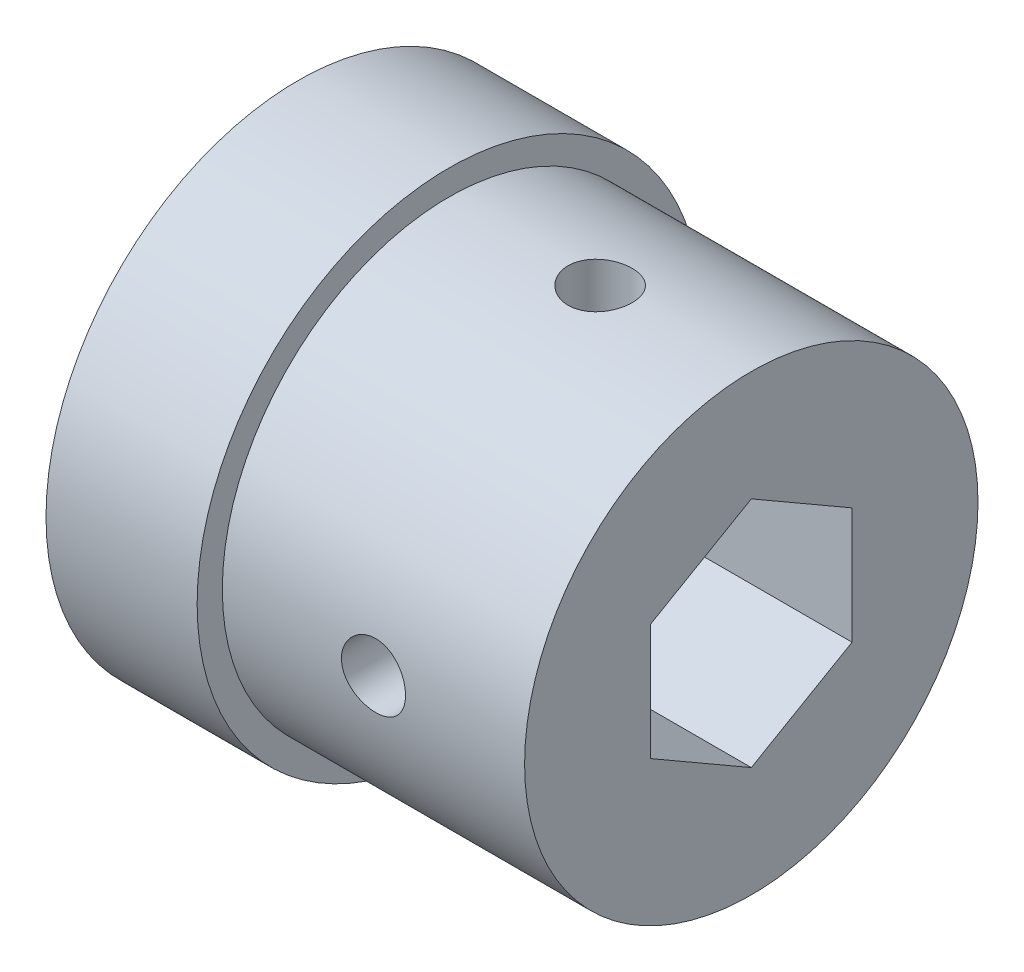
from build123d import *

# Parameters (mm, degrees)
SKETCH1_R               = 14.2875
BOSS_EXTRUDE1_DEPTH     = 19.05
SKETCH2_R               = 15.875
BOSS_EXTRUDE2_DEPTH     = 9.525
CUT_EXTRUDE1_DEPTH      = 37.339535977
CUT_EXTRUDE2_DEPTH      = 30.443738723
CUT_EXTRUDE2_DEPTH_BACK = 30.443738723
SKETCH5_R               = 2.0193
CUT_EXTRUDE3_DEPTH      = 30.443738788
CUT_EXTRUDE3_DEPTH_BACK = 30.443738788
SKETCH6_R               = 2.0193


with BuildPart() as part:
    # Sketch1 → Boss-Extrude1 (new body)
    with BuildSketch(Plane(origin=(0, 0, 0), x_dir=(0, 0, -1), z_dir=(1, 0, 0))):
        Circle(SKETCH1_R)
    extrude(amount=BOSS_EXTRUDE1_DEPTH)

    # Sketch2 → Boss-Extrude2 (add)
    with BuildSketch(Plane.ZY):
        Circle(SKETCH2_R)
    extrude(amount=BOSS_EXTRUDE2_DEPTH)

    # Sketch4 → Cut-Extrude1 (cut, through all)
    with BuildSketch(Plane.ZY.offset(9.525)):
        Polygon((0, 7.332348419), (-6.35, 3.666174209), (-6.35, -3.666174209), (0, -7.332348419), (6.35, -3.666174209), (6.35, 3.666174209), align=None)
    extrude(amount=-CUT_EXTRUDE1_DEPTH, mode=Mode.SUBTRACT)

    # Sketch5 → Cut-Extrude2 (cut, two sides: drawn at the far end of the back side and taken through both)
    with BuildSketch(Plane.XY.offset(-CUT_EXTRUDE2_DEPTH_BACK)):
        with Locations((9.525, 0)):
            Circle(SKETCH5_R)
    extrude(amount=CUT_EXTRUDE2_DEPTH + CUT_EXTRUDE2_DEPTH_BACK, mode=Mode.SUBTRACT)

    # Sketch6 → Cut-Extrude3 (cut, two sides: drawn at the far end of the back side and taken through both)
    with BuildSketch(Plane(origin=(0, 0, 0), x_dir=(1, 0, 0), z_dir=(0, 1, 0)).offset(-CUT_EXTRUDE3_DEPTH_BACK)):
        with Locations((9.525, 0)):
            Circle(SKETCH6_R)
    extrude(amount=CUT_EXTRUDE3_DEPTH + CUT_EXTRUDE3_DEPTH_BACK, mode=Mode.SUBTRACT)


solid = part.part
